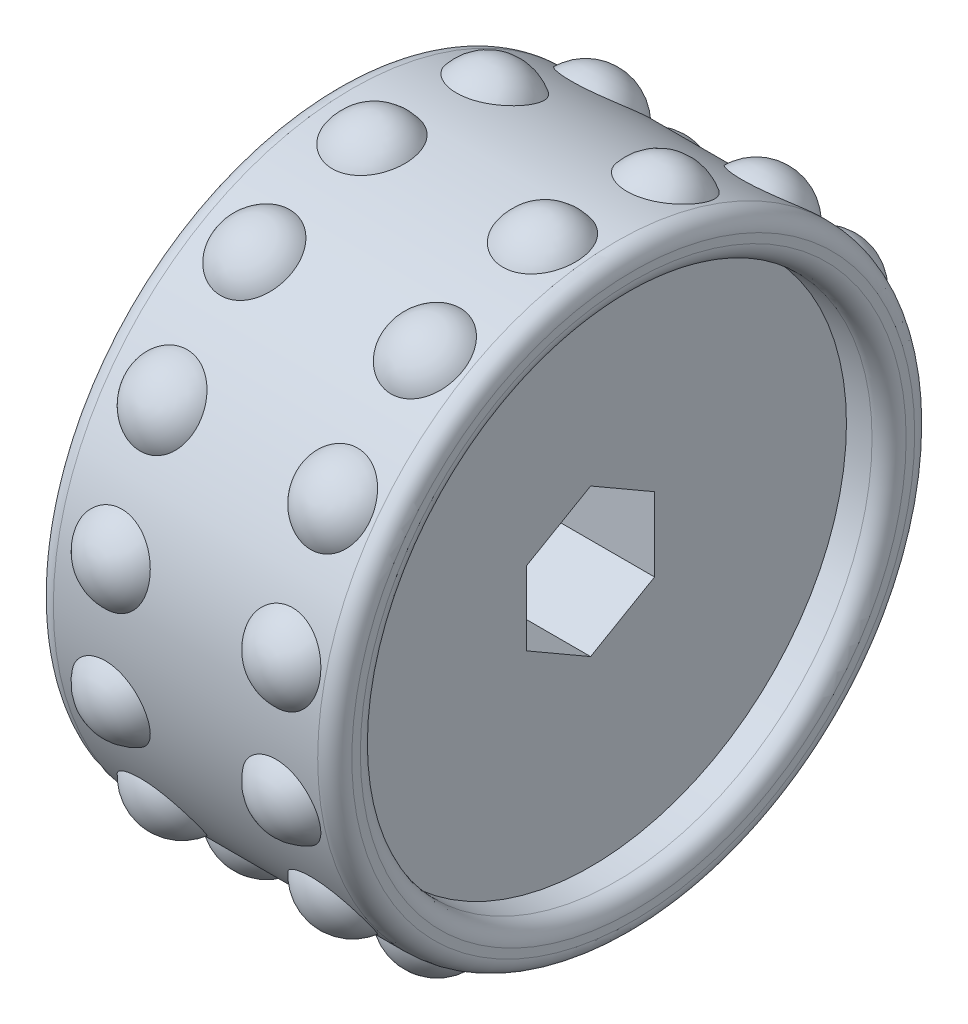
from build123d import *

# Parameters (mm, degrees)
SKETCH1_R           = 7
BOSS_EXTRUDE1_DEPTH = 7
CUT_EXTRUDE2_START  = 7
SKETCH1_4_R         = 5.999999999999999
CUT_EXTRUDE2_DEPTH  = 1
CUT_EXTRUDE3_START  = 6
CUT_EXTRUDE3_DEPTH  = 19.12435565298214
CIRPATTERN1_COUNT   = 15
CIRPATTERN1_ANGLE   = 336.00000000000074
FILLET1_R           = 0.4


with BuildPart() as part:
    # Sketch1 → Boss-Extrude1 (new body)
    with BuildSketch(Plane(origin=(0, 0, 0), x_dir=(0, 0, -1), z_dir=(1, 0, 0))):
        Circle(SKETCH1_R)
    extrude(amount=BOSS_EXTRUDE1_DEPTH)

    # Sketch1<4> → Cut-Extrude2 (cut)
    with BuildSketch(Plane(origin=(0, 0, 0), x_dir=(0, 0, -1), z_dir=(1, 0, 0)).offset(CUT_EXTRUDE2_START)):
        Circle(SKETCH1_4_R)
    extrude(amount=-CUT_EXTRUDE2_DEPTH, mode=Mode.SUBTRACT)

    # Sketch1<6> → Cut-Extrude3 (cut, through all)
    with BuildSketch(Plane(origin=(0, 0, 0), x_dir=(0, 0, -1), z_dir=(1, 0, 0)).offset(CUT_EXTRUDE3_START)):
        Polygon((1.4999999999999998, -0.8660254037844384), (1.4999999999999998, 0.8660254037844394), (4.3e-16, 1.7320508075688779), (-1.5000000000000004, 0.8660254037844392), (-1.5000000000000002, -0.8660254037844383), (-2.2e-16, -1.7320508075688774), align=None)
    extrude(amount=-CUT_EXTRUDE3_DEPTH, mode=Mode.SUBTRACT)

    # Sketch2 → Revolve1 (revolve)
    with BuildSketch(Plane(origin=(1.6, 0, 0), x_dir=(0, 0, -1), z_dir=(1, 0, 0))):
        with BuildLine():
            Line((7, 0), (7.4788020079427335, 0))
            ThreePointArc((7.4788020079427335, 0), (7.333634945123652, 0.5404993631682008), (6.937202049035839, 0.9355360660353889))
            ThreePointArc((6.937202049035839, 0.9355360660353889), (6.984282867383411, 0.46882067827109236), (7, 0))
        make_face()
    revolve1 = revolve(axis=Axis((1.6, 0, -7), (0, 0, -1)))

    # Sketch3 → Revolve2 (revolve)
    with BuildSketch(Plane(origin=(5.6, 0, 0), x_dir=(0, 0, -1), z_dir=(1, 0, 0))):
        with BuildLine():
            Line((7, 0), (7.4788020079427335, 0))
            ThreePointArc((7.4788020079427335, 0), (7.333634945123651, 0.5404993631682005), (6.937202049035839, 0.9355360660353887))
            ThreePointArc((6.937202049035839, 0.9355360660353887), (6.984282867383411, 0.46882067827109236), (7, 0))
        make_face()
    revolve2 = revolve(axis=Axis((5.6, 0, -7), (0, 0, -1)))

    # CirPattern1: Revolve1, Revolve2 ×15 about axis
    cirpattern1_axis = Axis((0, 1e-17, 8e-17), (-1, 0, 0))
    add([revolve1.rotate(cirpattern1_axis, i * CIRPATTERN1_ANGLE / (CIRPATTERN1_COUNT - 1)) for i in range(1, CIRPATTERN1_COUNT)])
    add([revolve2.rotate(cirpattern1_axis, i * CIRPATTERN1_ANGLE / (CIRPATTERN1_COUNT - 1)) for i in range(1, CIRPATTERN1_COUNT)])

    # Fillet1
    fillet1_edges = [part.edges().sort_by_distance(p)[0] for p in [
        (0, 8.6e-16, 7),
        (7, 8.6e-16, 7),
        (7, 7.3e-16, 5.999999999999999),
    ]]
    fillet(fillet1_edges, radius=FILLET1_R)


solid = part.part
